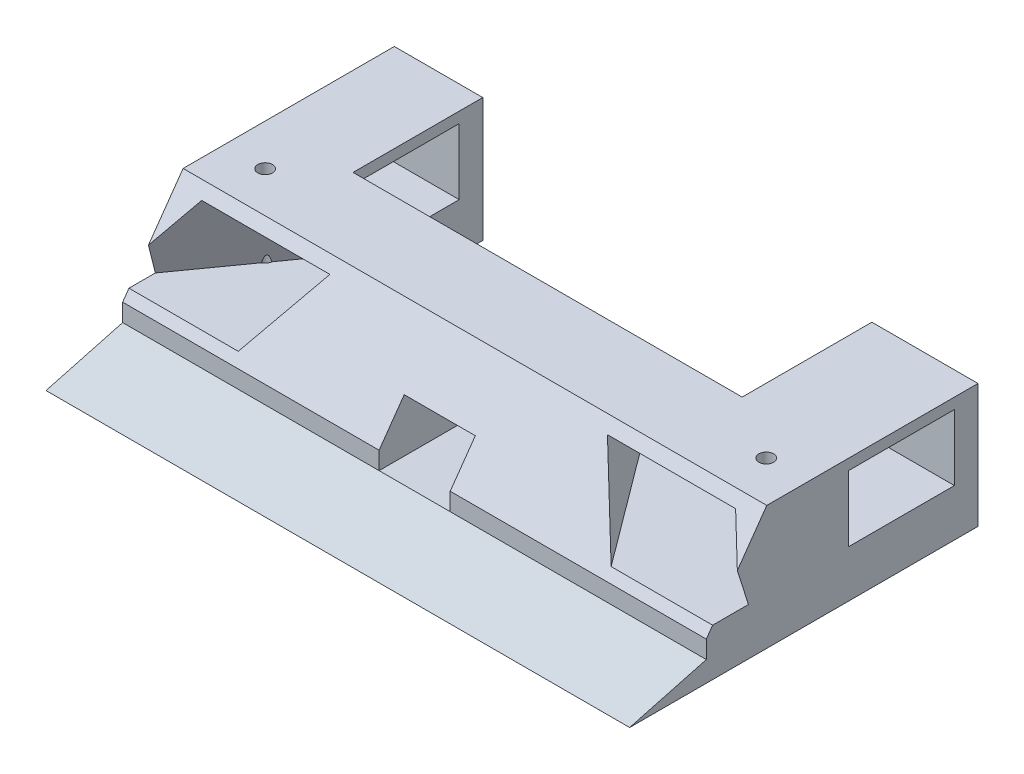
from build123d import *

# Parameters (mm, degrees)
BOSS_EXTRUDE2_DEPTH        = 25
SKETCH4_W                  = 18
SKETCH4_H                  = 11.172071032
CUT_EXTRUDE1_DEPTH         = 110.64235231
CUT_SWEEP3_START           = -47.833237702
CUT_SWEEP3_DEPTH           = 40.241500367
CUT_SWEEP4_START           = 2.134725454
CUT_SWEEP4_DEPTH           = 40.561080438
SKETCH24_W                 = 3
SKETCH24_H                 = 22.191771217
CUT_EXTRUDE15_DEPTH        = 15
CORTAR_EXTRUIR1_DEPTH      = 110.64235231
CORTAR_EXTRUIR1_DEPTH_BACK = 110.64235231
CORTAR_EXTRUIR2_DEPTH      = 110.64235231
CORTAR_EXTRUIR2_DEPTH_BACK = 110.64235231
CORTAR_EXTRUIR3_DEPTH      = 76.49647267
CORTAR_EXTRUIR3_DEPTH_BACK = 76.49647267
CORTAR_EXTRUIR4_DEPTH      = 108.627401408
CORTAR_EXTRUIR4_DEPTH_BACK = 108.627401408
CORTAR_EXTRUIR7_DEPTH      = 68.452835826
CORTAR_EXTRUIR7_DEPTH_BACK = 68.452835826
CROQUIS9_R                 = 1.245
CORTAR_EXTRUIR6_DEPTH      = 67.906302907
CORTAR_EXTRUIR6_DEPTH_BACK = 10


# Read off the part's stored shape, not the designer's step: Cut-Sweep3, Cut-Sweep4
with BuildPart() as part:
    # Sketch1 → Boss-Extrude2 (new body)
    with BuildSketch(Plane(origin=(0, 0, 0), x_dir=(1, 0, 0), z_dir=(0, 1, 0))):
        Polygon((26.674798416, 25.056972824), (44.674798416, 25.056972824), (44.674798416, -39.943027176), (-54.325201584, -39.943027176), (-54.325201584, 25.056972824), (-36.325201584, 25.056972824), (-36.325201584, 10.056972824), (26.674798416, 10.056972824), align=None)
    extrude(amount=BOSS_EXTRUDE2_DEPTH)

    # Sketch4 → Cut-Extrude1 (cut, through all)
    with BuildSketch(Plane(origin=(44.674798416, 0, 0), x_dir=(0, 0, -1), z_dir=(1, 0, 0))):
        Polygon((-39.943027176, 25), (-39.943027176, 0), (-21.024366767, 6.487240423), (-7.943027176, 25), align=None)
        with Locations((12.056972824, 13.586035516)):
            Rectangle(SKETCH4_W, SKETCH4_H)
    extrude(amount=-CUT_EXTRUDE1_DEPTH, mode=Mode.SUBTRACT)

    # Cut-Sweep3 outline → Cut-Sweep3 (cut)
    with BuildSketch(Plane(origin=(0, 0, 0), x_dir=(0.8133953590059209, 0, 0.5817112599457132), z_dir=(0.5817112599457132, 0, -0.8133953590059209)).offset(CUT_SWEEP3_START)):
        Polygon((-17.497304793, -8), (-35.180519898, -8), (-33.55372918, -19.172071032), (-15.870514075, -19.172071032), align=None)
    extrude(amount=CUT_SWEEP3_DEPTH, mode=Mode.SUBTRACT)

    # Cut-Sweep4 outline → Cut-Sweep4 (cut)
    with BuildSketch(Plane(origin=(0, 0, 0), x_dir=(0.8018445876826973, 0, -0.5975326411201026), z_dir=(0.5975326411201026, 0, 0.8018445876826972)).offset(CUT_SWEEP4_START)):
        Polygon((10.094047266, 8), (27.526148602, 8), (25.412737953, 19.172071032), (7.980636617, 19.172071032), align=None)
    extrude(amount=CUT_SWEEP4_DEPTH, mode=Mode.SUBTRACT)

    # Sketch24 → Cut-Extrude15 (cut)
    with BuildSketch(Plane(origin=(0, 0, -25.056972824), x_dir=(-1, 0, 0), z_dir=(0, 0, -1))):
        with Locations((37.825201584, 11.095885609)):
            Rectangle(SKETCH24_W, SKETCH24_H)
    extrude(amount=-CUT_EXTRUDE15_DEPTH, mode=Mode.SUBTRACT)

    # Croquis2 → Cortar-Extruir1 (cut, two sides: drawn at the far end of the back side and taken through both)
    with BuildSketch(Plane(origin=(44.674798416, 0, 0), x_dir=(0, 0, -1), z_dir=(1, 0, 0)).offset(-CORTAR_EXTRUIR1_DEPTH_BACK)):
        Polygon((-21.024366767, 5.069239779), (-21.024366767, 6.487240423), (-39.943027176, 0), align=None)
    extrude(amount=CORTAR_EXTRUIR1_DEPTH + CORTAR_EXTRUIR1_DEPTH_BACK, mode=Mode.SUBTRACT)

    # Croquis3 → Cortar-Extruir2 (cut, two sides: drawn at the far end of the back side and taken through both)
    with BuildSketch(Plane(origin=(44.674798416, 0, 0), x_dir=(0, 0, -1), z_dir=(1, 0, 0)).offset(-CORTAR_EXTRUIR2_DEPTH_BACK)):
        Polygon((-21.024366767, 3.483339502), (-21.024366767, 5.069239779), (-39.943027176, 0), (-34.024366767, 0), align=None)
    extrude(amount=CORTAR_EXTRUIR2_DEPTH + CORTAR_EXTRUIR2_DEPTH_BACK, mode=Mode.SUBTRACT)

    # Croquis4 → Cortar-Extruir3 (cut, two sides: drawn at the far end of the back side and taken through both)
    with BuildSketch(Plane.XY.offset(21.024366767).offset(-CORTAR_EXTRUIR3_DEPTH_BACK)):
        Polygon((-4.825201584, 3.483339502), (1.234798416, 3.483339502), (1.234798416, 12.513339502), (-4.795201584, 12.513339502), (-10.825201584, 12.513339502), (-10.825201584, 3.483339502), align=None)
    extrude(amount=CORTAR_EXTRUIR3_DEPTH + CORTAR_EXTRUIR3_DEPTH_BACK, mode=Mode.SUBTRACT)

    # Croquis5 → Cortar-Extruir4 (cut, two sides: drawn at the far end of the back side and taken through both)
    with BuildSketch(Plane(origin=(44.674798416, 0, 0), x_dir=(0, 0, -1), z_dir=(1, 0, 0)).offset(-CORTAR_EXTRUIR4_DEPTH_BACK)):
        Polygon((-10.769475505, 21), (-7.943027176, 21), (25.056972824, 21), (25.056972824, 25), (-7.943027176, 25), align=None)
    extrude(amount=CORTAR_EXTRUIR4_DEPTH + CORTAR_EXTRUIR4_DEPTH_BACK, mode=Mode.SUBTRACT)

    # Croquis9 → Cortar-Extruir7 (cut, two sides: drawn at the far end of the back side and taken through both)
    with BuildSketch(Plane(origin=(0, 21, 0), x_dir=(1, 0, 0), z_dir=(0, 1, 0)).offset(-CORTAR_EXTRUIR7_DEPTH_BACK)):
        with Locations(Location((-47.325201584, -3.856251341, 0), (0, 0, 270))):
            Circle(CROQUIS9_R)
        with Locations(Location((37.674798416, -3.856251341, 0), (0, 0, 270))):
            Circle(CROQUIS9_R)
    extrude(amount=CORTAR_EXTRUIR7_DEPTH + CORTAR_EXTRUIR7_DEPTH_BACK, mode=Mode.SUBTRACT)

    # Croquis7 → Cortar-Extruir6 (cut, two sides: drawn at the far end of the back side and taken through both)
    with BuildSketch(Plane.XZ.offset(-19.172071032).offset(-CORTAR_EXTRUIR6_DEPTH_BACK)):
        Polygon((-4.825201584, -3.056972824), (26.674798416, -3.056972824), (26.674798416, -10.056972824), (-4.825201584, -10.056972824), (-39.325201584, -10.056972824), (-39.325201584, -3.056972824), align=None)
    extrude(amount=CORTAR_EXTRUIR6_DEPTH + CORTAR_EXTRUIR6_DEPTH_BACK, mode=Mode.SUBTRACT)


solid = part.part
